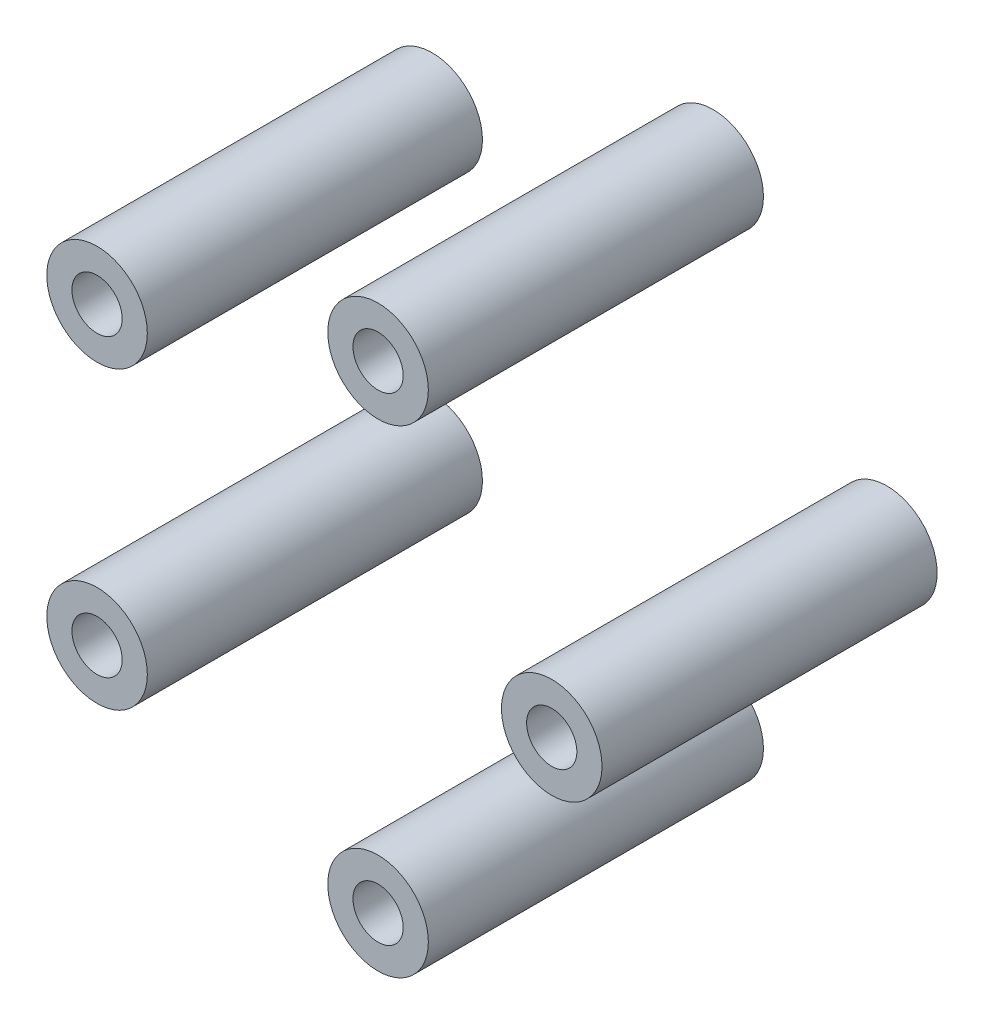
from build123d import *

# Parameters (mm, degrees)
BOSS_EXTRUDE1_DEPTH        = 12
BOSS_EXTRUDE1_DEPTH_BACK   = 8
SKETCH2_R                  = 3
SKETCH2_R_2                = 1.5
BOSS_EXTRUDE1_2_DEPTH      = 12
BOSS_EXTRUDE1_2_DEPTH_BACK = 8
BOSS_EXTRUDE1_3_DEPTH      = 12
BOSS_EXTRUDE1_3_DEPTH_BACK = 8
BOSS_EXTRUDE1_4_DEPTH      = 12
BOSS_EXTRUDE1_4_DEPTH_BACK = 8
BOSS_EXTRUDE1_5_DEPTH      = 12
BOSS_EXTRUDE1_5_DEPTH_BACK = 8


with BuildPart() as part:
    # Sketch2 → Boss-Extrude1 (new, two sides: drawn at the far end of the back side and taken through both)
    with BuildSketch(Plane.XY.offset(-5.5).offset(-BOSS_EXTRUDE1_DEPTH_BACK)):
        with Locations((-13.335254916, 8.816778784)):
            Circle(SKETCH2_R)
        with Locations((-13.335254916, 8.816778784)):
            Circle(SKETCH2_R_2, mode=Mode.SUBTRACT)
    extrude(amount=BOSS_EXTRUDE1_DEPTH + BOSS_EXTRUDE1_DEPTH_BACK)


with BuildPart() as body_2:
    # Sketch2 → Boss-Extrude1 2 (new, two sides: drawn at the far end of the back side and taken through both)
    with BuildSketch(Plane.XY.offset(-5.5).offset(-BOSS_EXTRUDE1_2_DEPTH_BACK)):
        with Locations((3.435254916, 14.265847744)):
            Circle(SKETCH2_R)
        with Locations((3.435254916, 14.265847744)):
            Circle(SKETCH2_R_2, mode=Mode.SUBTRACT)
    extrude(amount=BOSS_EXTRUDE1_2_DEPTH + BOSS_EXTRUDE1_2_DEPTH_BACK)


with BuildPart() as body_3:
    # Sketch2 → Boss-Extrude1 3 (new, two sides: drawn at the far end of the back side and taken through both)
    with BuildSketch(Plane.XY.offset(-5.5).offset(-BOSS_EXTRUDE1_3_DEPTH_BACK)):
        with Locations((13.8, 0)):
            Circle(SKETCH2_R)
        with Locations((13.8, 0)):
            Circle(SKETCH2_R_2, mode=Mode.SUBTRACT)
    extrude(amount=BOSS_EXTRUDE1_3_DEPTH + BOSS_EXTRUDE1_3_DEPTH_BACK)


with BuildPart() as body_4:
    # Sketch2 → Boss-Extrude1 4 (new, two sides: drawn at the far end of the back side and taken through both)
    with BuildSketch(Plane.XY.offset(-5.5).offset(-BOSS_EXTRUDE1_4_DEPTH_BACK)):
        with Locations((3.435254916, -14.265847744)):
            Circle(SKETCH2_R)
        with Locations((3.435254916, -14.265847744)):
            Circle(SKETCH2_R_2, mode=Mode.SUBTRACT)
    extrude(amount=BOSS_EXTRUDE1_4_DEPTH + BOSS_EXTRUDE1_4_DEPTH_BACK)


with BuildPart() as body_5:
    # Sketch2 → Boss-Extrude1 5 (new, two sides: drawn at the far end of the back side and taken through both)
    with BuildSketch(Plane.XY.offset(-5.5).offset(-BOSS_EXTRUDE1_5_DEPTH_BACK)):
        with Locations((-13.335254916, -8.816778784)):
            Circle(SKETCH2_R)
        with Locations((-13.335254916, -8.816778784)):
            Circle(SKETCH2_R_2, mode=Mode.SUBTRACT)
    extrude(amount=BOSS_EXTRUDE1_5_DEPTH + BOSS_EXTRUDE1_5_DEPTH_BACK)


solid = Compound([part.part, body_2.part, body_3.part, body_4.part, body_5.part])
